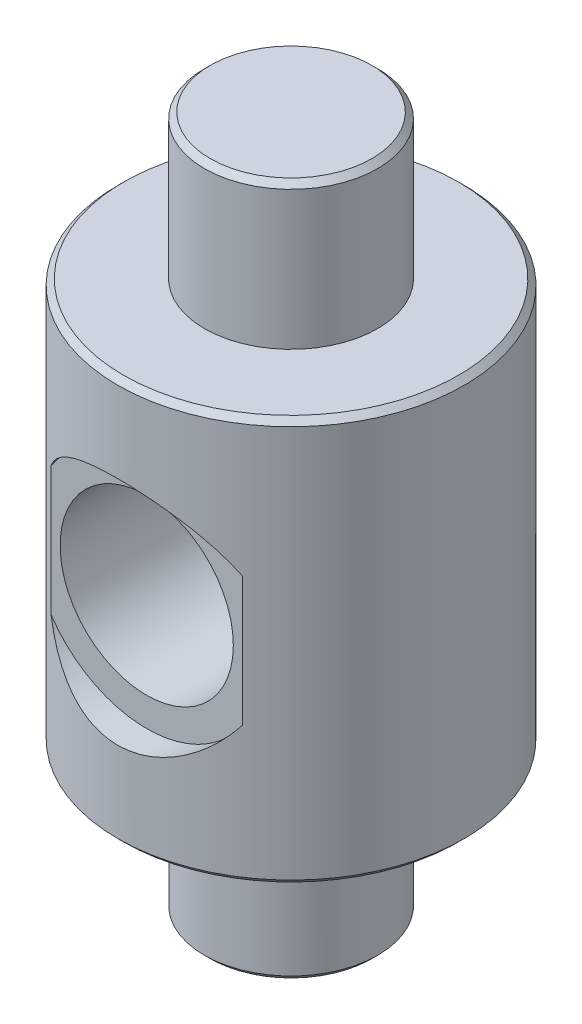
from build123d import *

# Parameters (mm, degrees)
SKETCH4_R          = 2
CUT_EXTRUDE1_DEPTH = 0.5
SKETCH5_R          = 1.5
CUT_EXTRUDE2_DEPTH = 14.536986433
CHAMFER1_SIZE      = 0.1


with BuildPart() as part:
    # Sketch1 → Revolve2 (revolve)
    with BuildSketch(Plane.XY):
        Polygon((0, 12), (-1.5, 12), (-1.5, 9.5), (-3, 9.5), (-3, 2.5), (-1.5, 2.5), (-1.5, 0), (0, 0), align=None)
    revolve(axis=Axis((0, 0, 0), (0, -1, 0)))

    # Sketch4 → Cut-Extrude1 (cut)
    with BuildSketch(Plane.XY.offset(3)):
        with Locations((0, 6)):
            Circle(SKETCH4_R)
    cut_extrude1 = extrude(amount=-CUT_EXTRUDE1_DEPTH, mode=Mode.SUBTRACT)

    # Mirror1: Cut-Extrude1 across plane
    add(cut_extrude1.mirror(Plane.XY), mode=Mode.SUBTRACT)

    # Sketch5 → Cut-Extrude2 (cut, through all)
    with BuildSketch(Plane.XY.offset(2.5)):
        with Locations((0, 6)):
            Circle(SKETCH5_R)
    extrude(amount=-CUT_EXTRUDE2_DEPTH, mode=Mode.SUBTRACT)

    # Chamfer1
    chamfer1_edges = [part.edges().sort_by_distance(p)[0] for p in [
        (1.5, 0, 0),
        (3, 2.5, 0),
        (3, 9.5, 0),
        (1.5, 12, 0),
    ]]
    chamfer(chamfer1_edges, length=CHAMFER1_SIZE)


solid = part.part
